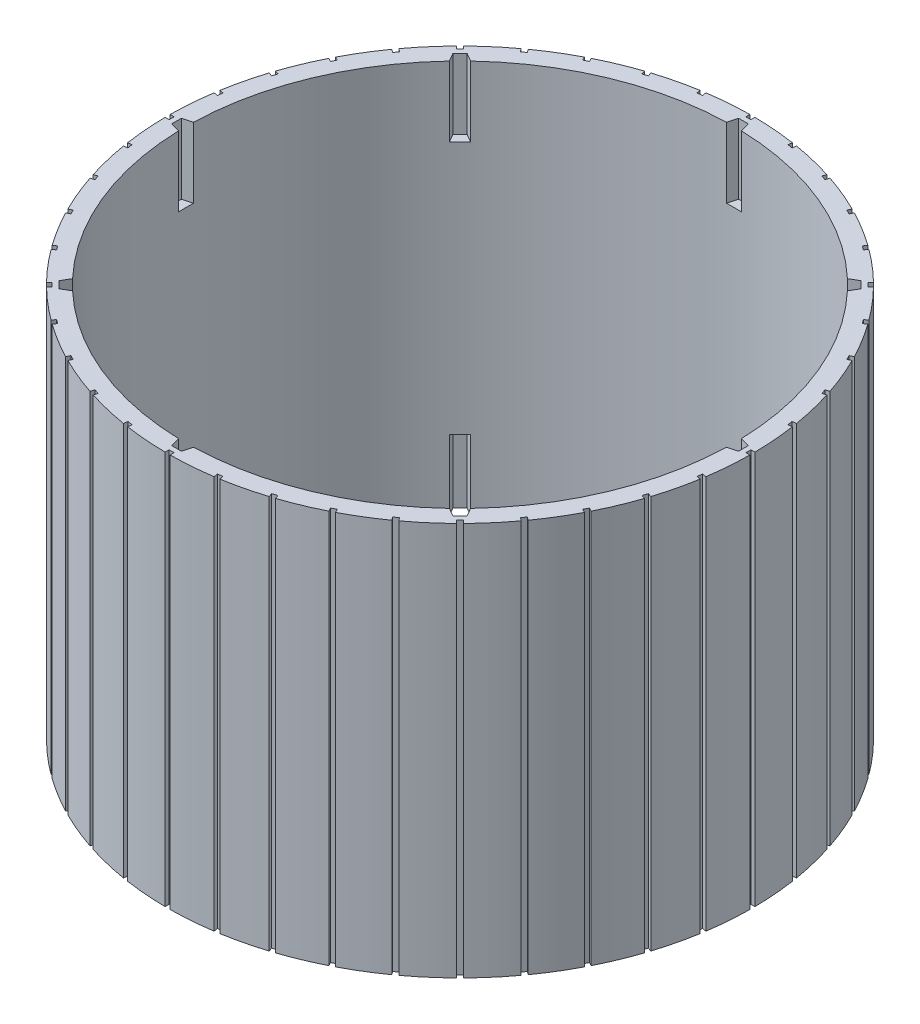
from build123d import *
from build123d.topology import SkipClean

# Parameters (mm, degrees)
SKETCH1_R            = 87.3125
BOSS_EXTRUDE1_DEPTH  = 62.70625
FILLET1_R            = 3.175
FILLET1_OF_MIRROR1_R = 3.175
FILLET2_R            = 21.59
CUT_EXTRUDE1_DEPTH   = 19.05
CUT_EXTRUDE2_START   = -6.952
CUT_EXTRUDE2_DEPTH   = 60.452
CUT_EXTRUDE5_START   = -148.1125
CUT_EXTRUDE5_DEPTH   = 60.452
SKETCH6_R            = 93.6625
SKETCH6_R_2          = 93.1545
CUT_EXTRUDE6_DEPTH   = 183.407134977


with BuildPart() as part:
    # Sketch1 → Boss-Extrude1 (new, symmetric)
    with BuildSketch(Plane(origin=(0, 0, 0), x_dir=(1, 0, 0), z_dir=(0, 1, 0))):
        with BuildLine():
            Line((13.589924983, 90.877419188), (13.867539309, 92.630207059))
            ThreePointArc((13.867539309, 92.630207059), (7.348675054, 93.373769771), (0.79375, 93.659136592))
            Line((0.79375, 93.659136592), (0.79375, 91.8845))
            Line((0.79375, 91.8845), (-0.79375, 91.8845))
            Line((-0.79375, 91.8845), (-0.79375, 93.659136592))
            ThreePointArc((-0.79375, 93.659136592), (-7.348675054, 93.373769771), (-13.867539309, 92.630207059))
            Line((-13.867539309, 92.630207059), (-13.589924983, 90.877419188))
            Line((-13.589924983, 90.877419188), (-15.157880223, 90.629079475))
            Line((-15.157880223, 90.629079475), (-15.435494549, 92.381867346))
            ThreePointArc((-15.435494549, 92.381867346), (-21.865076392, 91.074597669), (-28.187363776, 89.320414406))
            Line((-28.187363776, 89.320414406), (-27.63897091, 87.632634711))
            Line((-27.63897091, 87.632634711), (-29.148773129, 87.142070232))
            Line((-29.148773129, 87.142070232), (-29.697165995, 88.829849927))
            ThreePointArc((-29.697165995, 88.829849927), (-35.843086984, 86.532866714), (-41.813121798, 83.811256713))
            Line((-41.813121798, 83.811256713), (-41.007453645, 82.230043931))
            Line((-41.007453645, 82.230043931), (-42.421926502, 81.509334013))
            Line((-42.421926502, 81.509334013), (-43.227594655, 83.090546794))
            ThreePointArc((-43.227594655, 83.090546794), (-48.938521818, 79.860409394), (-54.409301992, 76.238387726))
            Line((-54.409301992, 76.238387726), (-53.366196775, 74.802676564))
            Line((-53.366196775, 74.802676564), (-54.650511254, 73.869567476))
            Line((-54.650511254, 73.869567476), (-55.693616471, 75.305278638))
            ThreePointArc((-55.693616471, 75.305278638), (-60.828927827, 71.221523753), (-65.665744597, 66.788276612))
            Line((-65.665744597, 66.788276612), (-64.410887028, 65.533419043))
            Line((-64.410887028, 65.533419043), (-65.533419043, 64.410887028))
            Line((-65.533419043, 64.410887028), (-66.788276612, 65.665744597))
            ThreePointArc((-66.788276612, 65.665744597), (-71.221523753, 60.828927827), (-75.305278638, 55.693616471))
            Line((-75.305278638, 55.693616471), (-73.869567476, 54.650511254))
            Line((-73.869567476, 54.650511254), (-74.802676564, 53.366196775))
            Line((-74.802676564, 53.366196775), (-76.238387726, 54.409301992))
            ThreePointArc((-76.238387726, 54.409301992), (-79.860409394, 48.938521818), (-83.090546794, 43.227594655))
            Line((-83.090546794, 43.227594655), (-81.509334013, 42.421926502))
            Line((-81.509334013, 42.421926502), (-82.230043931, 41.007453645))
            Line((-82.230043931, 41.007453645), (-83.811256713, 41.813121798))
            ThreePointArc((-83.811256713, 41.813121798), (-86.532866714, 35.843086984), (-88.829849927, 29.697165995))
            Line((-88.829849927, 29.697165995), (-87.142070232, 29.148773129))
            Line((-87.142070232, 29.148773129), (-87.632634711, 27.63897091))
            Line((-87.632634711, 27.63897091), (-89.320414406, 28.187363776))
            ThreePointArc((-89.320414406, 28.187363776), (-91.074597669, 21.865076392), (-92.381867346, 15.435494549))
            Line((-92.381867346, 15.435494549), (-90.629079475, 15.157880223))
            Line((-90.629079475, 15.157880223), (-90.877419188, 13.589924983))
            Line((-90.877419188, 13.589924983), (-92.630207059, 13.867539309))
            ThreePointArc((-92.630207059, 13.867539309), (-93.373769771, 7.348675054), (-93.659136592, 0.79375))
            Line((-93.659136592, 0.79375), (-91.8845, 0.79375))
            Line((-91.8845, 0.79375), (-91.8845, -0.79375))
            Line((-91.8845, -0.79375), (-93.659136592, -0.79375))
            ThreePointArc((-93.659136592, -0.79375), (-93.373769771, -7.348675054), (-92.630207059, -13.867539309))
            Line((-92.630207059, -13.867539309), (-90.877419188, -13.589924983))
            Line((-90.877419188, -13.589924983), (-90.629079475, -15.157880223))
            Line((-90.629079475, -15.157880223), (-92.381867346, -15.435494549))
            ThreePointArc((-92.381867346, -15.435494549), (-91.074597669, -21.865076392), (-89.320414406, -28.187363776))
            Line((-89.320414406, -28.187363776), (-87.632634711, -27.63897091))
            Line((-87.632634711, -27.63897091), (-87.142070232, -29.148773129))
            Line((-87.142070232, -29.148773129), (-88.829849927, -29.697165995))
            ThreePointArc((-88.829849927, -29.697165995), (-86.532866714, -35.843086984), (-83.811256713, -41.813121798))
            Line((-83.811256713, -41.813121798), (-82.230043931, -41.007453645))
            Line((-82.230043931, -41.007453645), (-81.509334013, -42.421926502))
            Line((-81.509334013, -42.421926502), (-83.090546794, -43.227594655))
            ThreePointArc((-83.090546794, -43.227594655), (-79.860409394, -48.938521818), (-76.238387726, -54.409301992))
            Line((-76.238387726, -54.409301992), (-74.802676564, -53.366196775))
            Line((-74.802676564, -53.366196775), (-73.869567476, -54.650511254))
            Line((-73.869567476, -54.650511254), (-75.305278638, -55.693616471))
            ThreePointArc((-75.305278638, -55.693616471), (-71.221523753, -60.828927827), (-66.788276612, -65.665744597))
            Line((-66.788276612, -65.665744597), (-65.533419043, -64.410887028))
            Line((-65.533419043, -64.410887028), (-64.410887028, -65.533419044))
            Line((-64.410887028, -65.533419044), (-65.665744597, -66.788276612))
            ThreePointArc((-65.665744597, -66.788276612), (-60.828927827, -71.221523753), (-55.693616471, -75.305278638))
            Line((-55.693616471, -75.305278638), (-54.650511254, -73.869567476))
            Line((-54.650511254, -73.869567476), (-53.366196775, -74.802676564))
            Line((-53.366196775, -74.802676564), (-54.409301992, -76.238387726))
            ThreePointArc((-54.409301992, -76.238387726), (-48.938521818, -79.860409394), (-43.227594655, -83.090546794))
            Line((-43.227594655, -83.090546794), (-42.421926502, -81.509334013))
            Line((-42.421926502, -81.509334013), (-41.007453645, -82.230043931))
            Line((-41.007453645, -82.230043931), (-41.813121798, -83.811256713))
            ThreePointArc((-41.813121798, -83.811256713), (-35.843086984, -86.532866714), (-29.697165995, -88.829849927))
            Line((-29.697165995, -88.829849927), (-29.148773129, -87.142070232))
            Line((-29.148773129, -87.142070232), (-27.63897091, -87.632634711))
            Line((-27.63897091, -87.632634711), (-28.187363776, -89.320414406))
            ThreePointArc((-28.187363776, -89.320414406), (-21.865076392, -91.074597669), (-15.435494549, -92.381867346))
            Line((-15.435494549, -92.381867346), (-15.157880223, -90.629079475))
            Line((-15.157880223, -90.629079475), (-13.589924983, -90.877419188))
            Line((-13.589924983, -90.877419188), (-13.867539309, -92.630207059))
            ThreePointArc((-13.867539309, -92.630207059), (-7.348675054, -93.373769771), (-0.79375, -93.659136592))
            Line((-0.79375, -93.659136592), (-0.79375, -91.8845))
            Line((-0.79375, -91.8845), (0.79375, -91.8845))
            Line((0.79375, -91.8845), (0.79375, -93.659136592))
            ThreePointArc((0.79375, -93.659136592), (7.348675054, -93.373769771), (13.867539309, -92.630207059))
            Line((13.867539309, -92.630207059), (13.589924983, -90.877419188))
            Line((13.589924983, -90.877419188), (15.157880223, -90.629079475))
            Line((15.157880223, -90.629079475), (15.435494549, -92.381867346))
            ThreePointArc((15.435494549, -92.381867346), (21.865076392, -91.074597669), (28.187363776, -89.320414406))
            Line((28.187363776, -89.320414406), (27.63897091, -87.632634711))
            Line((27.63897091, -87.632634711), (29.148773129, -87.142070232))
            Line((29.148773129, -87.142070232), (29.697165995, -88.829849927))
            ThreePointArc((29.697165995, -88.829849927), (35.843086984, -86.532866714), (41.813121798, -83.811256713))
            Line((41.813121798, -83.811256713), (41.007453645, -82.230043931))
            Line((41.007453645, -82.230043931), (42.421926502, -81.509334013))
            Line((42.421926502, -81.509334013), (43.227594655, -83.090546794))
            ThreePointArc((43.227594655, -83.090546794), (48.938521818, -79.860409394), (54.409301992, -76.238387726))
            Line((54.409301992, -76.238387726), (53.366196775, -74.802676564))
            Line((53.366196775, -74.802676564), (54.650511254, -73.869567476))
            Line((54.650511254, -73.869567476), (55.693616471, -75.305278638))
            ThreePointArc((55.693616471, -75.305278638), (60.828927827, -71.221523753), (65.665744597, -66.788276612))
            Line((65.665744597, -66.788276612), (64.410887028, -65.533419043))
            Line((64.410887028, -65.533419043), (65.533419044, -64.410887028))
            Line((65.533419044, -64.410887028), (66.788276612, -65.665744597))
            ThreePointArc((66.788276612, -65.665744597), (71.221523753, -60.828927827), (75.305278638, -55.693616471))
            Line((75.305278638, -55.693616471), (73.869567476, -54.650511254))
            Line((73.869567476, -54.650511254), (74.802676564, -53.366196775))
            Line((74.802676564, -53.366196775), (76.238387726, -54.409301992))
            ThreePointArc((76.238387726, -54.409301992), (79.860409394, -48.938521818), (83.090546794, -43.227594655))
            Line((83.090546794, -43.227594655), (81.509334013, -42.421926502))
            Line((81.509334013, -42.421926502), (82.230043931, -41.007453645))
            Line((82.230043931, -41.007453645), (83.811256713, -41.813121798))
            ThreePointArc((83.811256713, -41.813121798), (86.532866714, -35.843086984), (88.829849927, -29.697165995))
            Line((88.829849927, -29.697165995), (87.142070232, -29.148773129))
            Line((87.142070232, -29.148773129), (87.632634711, -27.63897091))
            Line((87.632634711, -27.63897091), (89.320414406, -28.187363776))
            ThreePointArc((89.320414406, -28.187363776), (91.074597669, -21.865076392), (92.381867346, -15.435494549))
            Line((92.381867346, -15.435494549), (90.629079475, -15.157880223))
            Line((90.629079475, -15.157880223), (90.877419188, -13.589924983))
            Line((90.877419188, -13.589924983), (92.630207059, -13.867539309))
            ThreePointArc((92.630207059, -13.867539309), (93.373769771, -7.348675054), (93.659136592, -0.79375))
            Line((93.659136592, -0.79375), (91.8845, -0.79375))
            Line((91.8845, -0.79375), (91.8845, 0.79375))
            Line((91.8845, 0.79375), (93.659136592, 0.79375))
            ThreePointArc((93.659136592, 0.79375), (93.373769771, 7.348675054), (92.630207059, 13.867539309))
            Line((92.630207059, 13.867539309), (90.877419188, 13.589924983))
            Line((90.877419188, 13.589924983), (90.629079475, 15.157880223))
            Line((90.629079475, 15.157880223), (92.381867346, 15.435494549))
            ThreePointArc((92.381867346, 15.435494549), (91.074597669, 21.865076392), (89.320414406, 28.187363776))
            Line((89.320414406, 28.187363776), (87.632634711, 27.63897091))
            Line((87.632634711, 27.63897091), (87.142070232, 29.148773129))
            Line((87.142070232, 29.148773129), (88.829849927, 29.697165995))
            ThreePointArc((88.829849927, 29.697165995), (86.532866714, 35.843086984), (83.811256713, 41.813121798))
            Line((83.811256713, 41.813121798), (82.230043931, 41.007453645))
            Line((82.230043931, 41.007453645), (81.509334013, 42.421926502))
            Line((81.509334013, 42.421926502), (83.090546794, 43.227594655))
            ThreePointArc((83.090546794, 43.227594655), (79.860409394, 48.938521818), (76.238387726, 54.409301992))
            Line((76.238387726, 54.409301992), (74.802676564, 53.366196775))
            Line((74.802676564, 53.366196775), (73.869567476, 54.650511254))
            Line((73.869567476, 54.650511254), (75.305278638, 55.693616471))
            ThreePointArc((75.305278638, 55.693616471), (71.221523753, 60.828927827), (66.788276612, 65.665744597))
            Line((66.788276612, 65.665744597), (65.533419044, 64.410887028))
            Line((65.533419044, 64.410887028), (64.410887028, 65.533419044))
            Line((64.410887028, 65.533419044), (65.665744597, 66.788276612))
            ThreePointArc((65.665744597, 66.788276612), (60.828927827, 71.221523753), (55.693616471, 75.305278638))
            Line((55.693616471, 75.305278638), (54.650511254, 73.869567476))
            Line((54.650511254, 73.869567476), (53.366196775, 74.802676564))
            Line((53.366196775, 74.802676564), (54.409301992, 76.238387726))
            ThreePointArc((54.409301992, 76.238387726), (48.938521818, 79.860409394), (43.227594655, 83.090546794))
            Line((43.227594655, 83.090546794), (42.421926502, 81.509334013))
            Line((42.421926502, 81.509334013), (41.007453645, 82.230043931))
            Line((41.007453645, 82.230043931), (41.813121798, 83.811256713))
            ThreePointArc((41.813121798, 83.811256713), (35.843086984, 86.532866714), (29.697165995, 88.829849927))
            Line((29.697165995, 88.829849927), (29.148773129, 87.142070232))
            Line((29.148773129, 87.142070232), (27.63897091, 87.632634711))
            Line((27.63897091, 87.632634711), (28.187363776, 89.320414406))
            ThreePointArc((28.187363776, 89.320414406), (21.865076392, 91.074597669), (15.435494549, 92.381867346))
            Line((15.435494549, 92.381867346), (15.157880223, 90.629079475))
            Line((15.157880223, 90.629079475), (13.589924983, 90.877419188))
        make_face()
        with Locations(Location((0, 0, 0), (0, 0, 270))):
            Circle(SKETCH1_R, mode=Mode.SUBTRACT)
    extrude(amount=BOSS_EXTRUDE1_DEPTH, both=True)

    # Sketch2 → Revolve1 (revolve)
    with BuildSketch(Plane.XY):
        Polygon((0, 100.80625), (0, 40.95625), (-87.3125, 40.95625), (-87.3125, 47.30625), (-7.9375, 47.30625), (-7.9375, 100.80625), align=None)
    revolve1 = revolve(axis=Axis((0, 100.80625, 0), (0, -1, 0)))

    # Fillet1
    fillet1_edges = [part.edges().sort_by_distance(p)[0] for p in [
        (0, 40.95625, -87.3125),
    ]]
    fillet(fillet1_edges, radius=FILLET1_R)

    # Mirror1: Revolve1 across plane
    add(revolve1.mirror(Plane.ZX))

    # Fillet1 of Mirror1
    fillet1_of_mirror1_edges = [part.edges().sort_by_distance(p)[0] for p in [
        (0, -40.95625, -87.3125),
    ]]
    fillet(fillet1_of_mirror1_edges, radius=FILLET1_OF_MIRROR1_R)

    # Fillet2
    fillet2_edges = [part.edges().sort_by_distance(p)[0] for p in [
        (7.9375, 47.30625, 0),
        (7.9375, -47.30625, 0),
    ]]
    fillet(fillet2_edges, radius=FILLET2_R)

    # Sketch4 → Cut-Extrude1 (cut)
    with BuildSketch(Plane(origin=(0, 100.80625, 0), x_dir=(1, 0, 0), z_dir=(0, 1, 0))):
        with BuildLine():
            Line((6.35, 4.7625), (6.35, -4.7625))
            ThreePointArc((6.35, -4.7625), (7.9375, 0), (6.35, 4.7625))
        make_face()
    cut_extrude1 = extrude(amount=-CUT_EXTRUDE1_DEPTH, mode=Mode.SUBTRACT)

    # Mirror2: Cut-Extrude1 across plane
    add(cut_extrude1.mirror(Plane.ZX), mode=Mode.SUBTRACT)

    # Cut-Extrude2: read off the stored shape, not the designer's step
    # Cut-Extrude2 outline → Cut-Extrude2 (cut)
    with SkipClean():  # the faces are left unmerged after this step: merging them gives an invalid solid
        with BuildSketch(Plane.XZ.offset(47.30625).offset(CUT_EXTRUDE2_START)):
            with BuildLine():
                ThreePointArc((2.38125, -87.280022369), (33.413047188, -80.666231682), (60.032497656, -63.400093702))
                Line((60.032497656, -63.400093702), (62.738049161, -64.983113191))
                Line((62.738049161, -64.983113191), (64.983113191, -62.738049161))
                Line((64.983113191, -62.738049161), (63.400093702, -60.032497656))
                ThreePointArc((63.400093702, -60.032497656), (80.666231682, -33.413047188), (87.280022369, -2.38125))
                Line((87.280022369, -2.38125), (90.3125, -1.5875))
                Line((90.3125, -1.5875), (90.3125, 1.5875))
                Line((90.3125, 1.5875), (87.280022369, 2.38125))
                ThreePointArc((87.280022369, 2.38125), (80.666231682, 33.413047188), (63.400093702, 60.032497656))
                Line((63.400093702, 60.032497656), (64.983113191, 62.738049161))
                Line((64.983113191, 62.738049161), (62.738049161, 64.983113191))
                Line((62.738049161, 64.983113191), (60.032497656, 63.400093702))
                ThreePointArc((60.032497656, 63.400093702), (33.413047188, 80.666231682), (2.38125, 87.280022369))
                Line((2.38125, 87.280022369), (1.5875, 90.3125))
                Line((1.5875, 90.3125), (-1.5875, 90.3125))
                Line((-1.5875, 90.3125), (-2.38125, 87.280022369))
                ThreePointArc((-2.38125, 87.280022369), (-33.413047188, 80.666231682), (-60.032497656, 63.400093702))
                Line((-60.032497656, 63.400093702), (-62.738049161, 64.983113191))
                Line((-62.738049161, 64.983113191), (-64.983113191, 62.738049161))
                Line((-64.983113191, 62.738049161), (-63.400093702, 60.032497656))
                ThreePointArc((-63.400093702, 60.032497656), (-80.666231682, 33.413047188), (-87.280022369, 2.38125))
                Line((-87.280022369, 2.38125), (-90.3125, 1.5875))
                Line((-90.3125, 1.5875), (-90.3125, -1.5875))
                Line((-90.3125, -1.5875), (-87.280022369, -2.38125))
                ThreePointArc((-87.280022369, -2.38125), (-80.666231682, -33.413047188), (-63.400093702, -60.032497656))
                Line((-63.400093702, -60.032497656), (-64.983113191, -62.738049161))
                Line((-64.983113191, -62.738049161), (-62.738049161, -64.983113191))
                Line((-62.738049161, -64.983113191), (-60.032497656, -63.400093702))
                ThreePointArc((-60.032497656, -63.400093702), (-33.413047188, -80.666231682), (-2.38125, -87.280022369))
                Line((-2.38125, -87.280022369), (-1.5875, -90.3125))
                Line((-1.5875, -90.3125), (1.5875, -90.3125))
                Line((1.5875, -90.3125), (2.38125, -87.280022369))
            make_face()
        extrude(amount=CUT_EXTRUDE2_DEPTH, mode=Mode.SUBTRACT)

    # Cut-Extrude5: read off the stored shape, not the designer's step
    # Cut-Extrude5 outline → Cut-Extrude5 (cut)
    with SkipClean():  # the faces are left unmerged after this step: merging them gives an invalid solid
        with BuildSketch(Plane.XZ.offset(47.30625).offset(CUT_EXTRUDE5_START)):
            with BuildLine():
                ThreePointArc((2.38125, -87.280022369), (33.413047188, -80.666231682), (60.032497656, -63.400093702))
                Line((60.032497656, -63.400093702), (62.738049161, -64.983113191))
                Line((62.738049161, -64.983113191), (64.983113191, -62.738049161))
                Line((64.983113191, -62.738049161), (63.400093702, -60.032497656))
                ThreePointArc((63.400093702, -60.032497656), (80.666231682, -33.413047188), (87.280022369, -2.38125))
                Line((87.280022369, -2.38125), (90.3125, -1.5875))
                Line((90.3125, -1.5875), (90.3125, 1.5875))
                Line((90.3125, 1.5875), (87.280022369, 2.38125))
                ThreePointArc((87.280022369, 2.38125), (80.666231682, 33.413047188), (63.400093702, 60.032497656))
                Line((63.400093702, 60.032497656), (64.983113191, 62.738049161))
                Line((64.983113191, 62.738049161), (62.738049161, 64.983113191))
                Line((62.738049161, 64.983113191), (60.032497656, 63.400093702))
                ThreePointArc((60.032497656, 63.400093702), (33.413047188, 80.666231682), (2.38125, 87.280022369))
                Line((2.38125, 87.280022369), (1.5875, 90.3125))
                Line((1.5875, 90.3125), (-1.5875, 90.3125))
                Line((-1.5875, 90.3125), (-2.38125, 87.280022369))
                ThreePointArc((-2.38125, 87.280022369), (-33.413047188, 80.666231682), (-60.032497656, 63.400093702))
                Line((-60.032497656, 63.400093702), (-62.738049161, 64.983113191))
                Line((-62.738049161, 64.983113191), (-64.983113191, 62.738049161))
                Line((-64.983113191, 62.738049161), (-63.400093702, 60.032497656))
                ThreePointArc((-63.400093702, 60.032497656), (-80.666231682, 33.413047188), (-87.280022369, 2.38125))
                Line((-87.280022369, 2.38125), (-90.3125, 1.5875))
                Line((-90.3125, 1.5875), (-90.3125, -1.5875))
                Line((-90.3125, -1.5875), (-87.280022369, -2.38125))
                ThreePointArc((-87.280022369, -2.38125), (-80.666231682, -33.413047188), (-63.400093702, -60.032497656))
                Line((-63.400093702, -60.032497656), (-64.983113191, -62.738049161))
                Line((-64.983113191, -62.738049161), (-62.738049161, -64.983113191))
                Line((-62.738049161, -64.983113191), (-60.032497656, -63.400093702))
                ThreePointArc((-60.032497656, -63.400093702), (-33.413047188, -80.666231682), (-2.38125, -87.280022369))
                Line((-2.38125, -87.280022369), (-1.5875, -90.3125))
                Line((-1.5875, -90.3125), (1.5875, -90.3125))
                Line((1.5875, -90.3125), (2.38125, -87.280022369))
            make_face()
        extrude(amount=CUT_EXTRUDE5_DEPTH, mode=Mode.SUBTRACT)

    # Cut-Extrude9: read off the stored shape, not the designer's step
    # Cut-Extrude9 outline → Cut-Extrude9 (revolve, cut)
    with SkipClean():  # the faces are left unmerged after this step: merging them gives an invalid solid
        with BuildSketch(Plane.XY):
            with BuildLine():
                Line((87.3125, 40.35425), (85.997687087, 40.35425))
                ThreePointArc((85.997687087, 40.35425), (86.964752996, 39.225987173), (87.3125, 37.78125))
                Line((87.3125, 37.78125), (87.3125, 40.35425))
            make_face()
            with BuildLine():
                Line((87.3125, -40.35425), (87.3125, -37.78125))
                ThreePointArc((87.3125, -37.78125), (86.964752996, -39.225987173), (85.997687087, -40.35425))
                Line((85.997687087, -40.35425), (87.3125, -40.35425))
            make_face()
        revolve(axis=Axis((0, 0, 0), (0, 1, 0)), mode=Mode.SUBTRACT)
    add(part.part.scale(1), mode=Mode.REPLACE)  # the faces are merged on a copy

    # Sketch6 → Cut-Extrude6 (cut, through all)
    with BuildSketch(Plane(origin=(0, 62.70625, 0), x_dir=(1, 0, 0), z_dir=(0, 1, 0))):
        Circle(SKETCH6_R)
        Circle(SKETCH6_R_2, mode=Mode.SUBTRACT)
    extrude(amount=-CUT_EXTRUDE6_DEPTH, mode=Mode.SUBTRACT)


solid = part.part
